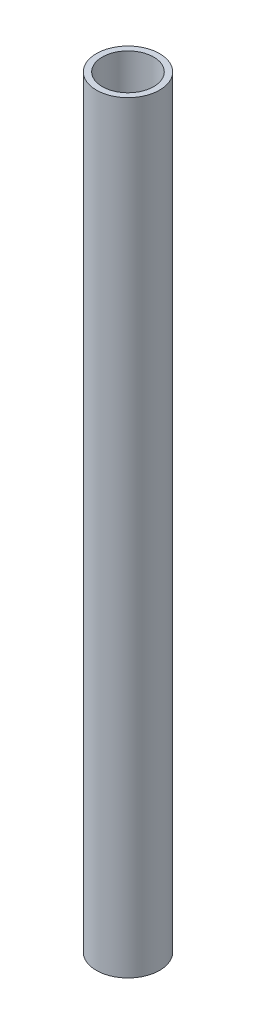
from build123d import *

# Parameters (mm, degrees)
SKETCH1_R           = 21.082
SKETCH1_R_2         = 17.11325
BOSS_EXTRUDE1_DEPTH = 508


with BuildPart() as part:
    # Sketch1 → Boss-Extrude1 (new body)
    with BuildSketch(Plane(origin=(0, 0, 0), x_dir=(1, 0, 0), z_dir=(0, 1, 0))):
        Circle(SKETCH1_R)
        Circle(SKETCH1_R_2, mode=Mode.SUBTRACT)
    extrude(amount=BOSS_EXTRUDE1_DEPTH)


solid = part.part
